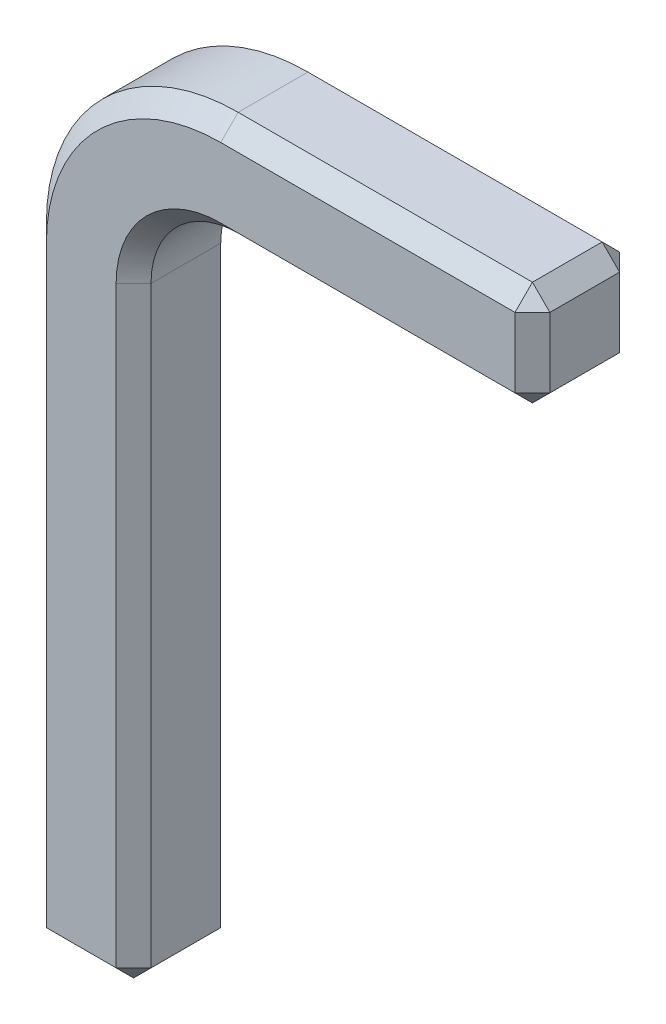
from build123d import *

# Parameters (mm, degrees)
BOSS_EXTRUDE1_DEPTH = 0.3
CHAMFER1_SIZE       = 0.1


with BuildPart() as part:
    # Sketch1 → Boss-Extrude1 (new, symmetric)
    with BuildSketch(Plane.XY):
        with BuildLine():
            Line((-0.6, 0), (-0.6, 3.5))
            ThreePointArc((-0.6, 3.5), (-0.277817459, 4.277817459), (0.5, 4.6))
            Line((0.5, 4.6), (2.287695887, 4.6))
            Line((2.287695887, 4.6), (2.287695887, 4))
            Line((2.287695887, 4), (0.5, 4))
            ThreePointArc((0.5, 4), (0.146446609, 3.853553391), (0, 3.5))
            Line((0, 3.5), (0, 0))
            Line((0, 0), (-0.6, 0))
        make_face()
    extrude(amount=BOSS_EXTRUDE1_DEPTH, both=True)

    # Chamfer1
    chamfer1_edges = [part.edges().sort_by_distance(p)[0] for p in [
        (-0.6, 0, 0),
        (-0.3, 0, 0.3),
        (0, 0, 0),
        (-0.3, 0, -0.3),
        (2.287695887, 4, 0),
        (2.287695887, 4.3, 0.3),
        (2.287695887, 4.6, 0),
        (2.287695887, 4.3, -0.3),
        (0, 1.75, -0.3),
        (0.146446609, 3.853553391, -0.3),
        (1.393847944, 4, -0.3),
        (1.393847944, 4.6, -0.3),
        (-0.277817459, 4.277817459, -0.3),
        (-0.6, 1.75, -0.3),
        (-0.6, 1.75, 0.3),
        (-0.277817459, 4.277817459, 0.3),
        (1.393847944, 4.6, 0.3),
        (0, 1.75, 0.3),
        (0.146446609, 3.853553391, 0.3),
        (1.393847944, 4, 0.3),
    ]]
    chamfer(chamfer1_edges, length=CHAMFER1_SIZE)


solid = part.part
